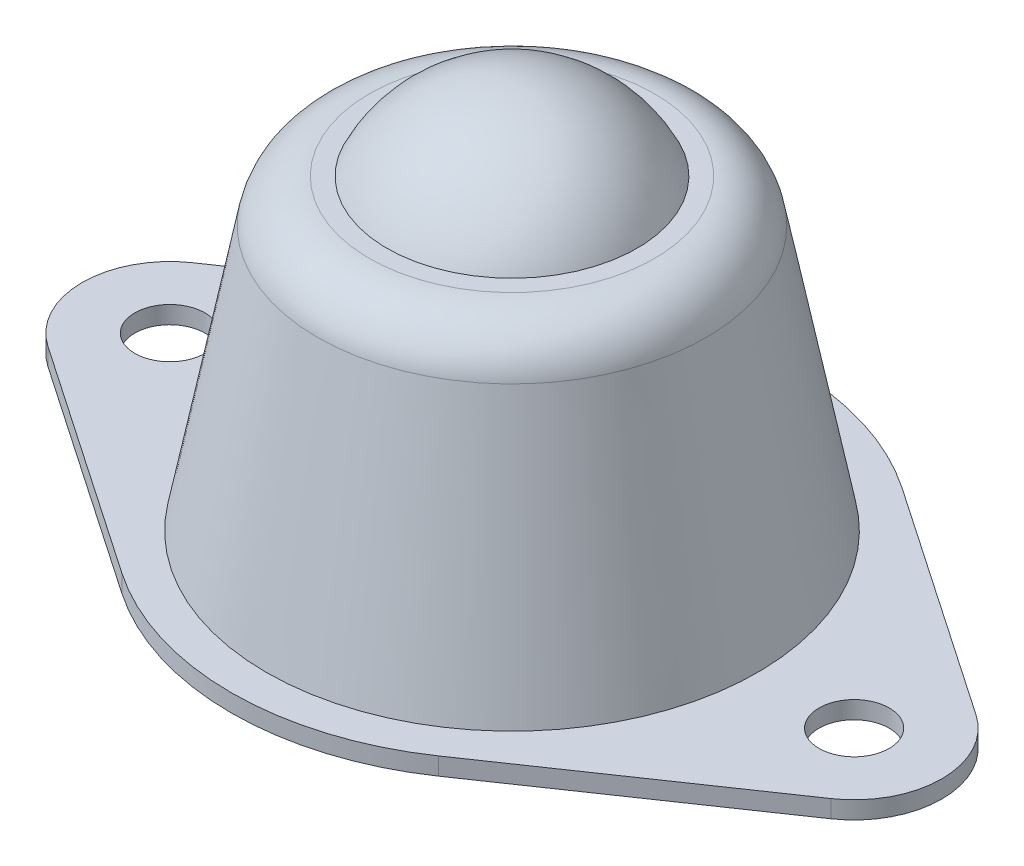
from build123d import *

# Parameters (mm, degrees)
SKETCH_1_R      = 2
EXTRUDE_1_DEPTH = 1


with BuildPart() as part:
    # 草圖1 → 填料-伸長1 (new body)
    with BuildSketch(Plane(origin=(0, 0, 0), x_dir=(1, 0, 0), z_dir=(0, 1, 0))):
        with BuildLine():
            Line((-22.320512821, 4.128523638), (-9.025641026, 13.211275642))
            ThreePointArc((-9.025641026, 13.211275642), (0, 16), (9.025641026, 13.211275642))
            Line((9.025641026, 13.211275642), (22.320512821, 4.128523638))
            ThreePointArc((22.320512821, 4.128523638), (24.5, 0), (22.320512821, -4.128523638))
            Line((22.320512821, -4.128523638), (9.025641026, -13.211275642))
            ThreePointArc((9.025641026, -13.211275642), (0, -16), (-9.025641026, -13.211275642))
            Line((-9.025641026, -13.211275642), (-22.320512821, -4.128523638))
            ThreePointArc((-22.320512821, -4.128523638), (-24.5, 0), (-22.320512821, 4.128523638))
        make_face()
        with Locations((19.5, 0)):
            Circle(SKETCH_1_R, mode=Mode.SUBTRACT)
        with Locations((-19.5, 0)):
            Circle(SKETCH_1_R, mode=Mode.SUBTRACT)
    extrude(amount=EXTRUDE_1_DEPTH)

    # 草圖2 → 旋轉1 (revolve)
    with BuildSketch(Plane.XY):
        with BuildLine():
            Line((-14, 1), (-11.076004298, 16.071375706))
            ThreePointArc((-11.076004298, 16.071375706), (-10.039566399, 17.814533119), (-8.130918594, 18.5))
            Line((-8.130918594, 18.5), (-7.130918594, 18.5))
            ThreePointArc((-7.130918594, 18.5), (-4.216040797, 21.780943047), (0, 23))
            Line((0, 23), (0, 1))
            Line((0, 1), (-14, 1))
        make_face()
    revolve(axis=Axis((0, 23, 0), (0, -1, 0)))


solid = part.part
